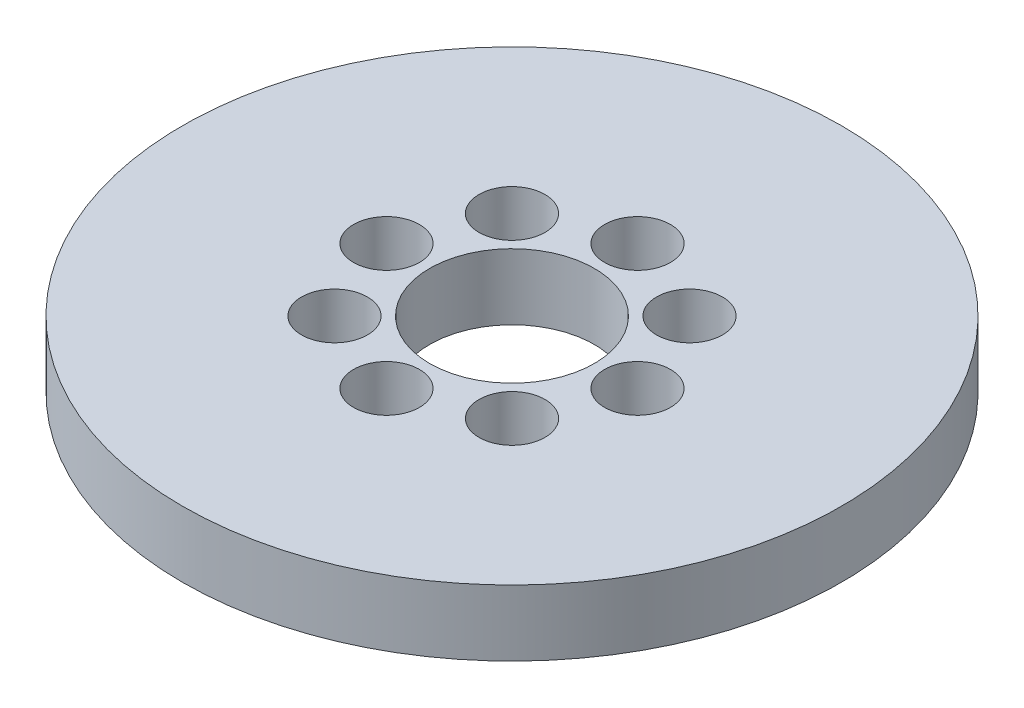
from build123d import *

# Parameters (mm, degrees)
SKETCH1_R           = 100
BOSS_EXTRUDE1_DEPTH = 20
SKETCH2_R           = 25
CUT_EXTRUDE1_DEPTH  = 143.828568571
SKETCH3_R           = 10
CUT_EXTRUDE2_DEPTH  = 17.838821247
CIRPATTERN1_COUNT   = 8


with BuildPart() as part:
    # Sketch1 → Boss-Extrude1 (new body)
    with BuildSketch(Plane(origin=(0, 0, 0), x_dir=(1, 0, 0), z_dir=(0, 1, 0))):
        Circle(SKETCH1_R)
    extrude(amount=BOSS_EXTRUDE1_DEPTH)

    # Sketch2 → Cut-Extrude1 (cut, through all)
    with BuildSketch(Plane(origin=(0, 0, 0), x_dir=(1, 0, 0), z_dir=(0, 1, 0))):
        Circle(SKETCH2_R)
    extrude(amount=CUT_EXTRUDE1_DEPTH, mode=Mode.SUBTRACT)

    # Sketch3 → Cut-Extrude2 (cut)
    with BuildSketch(Plane(origin=(0, 20, 0), x_dir=(1, 0, 0), z_dir=(0, 1, 0))):
        with Locations((-38.089036615, 0)):
            Circle(SKETCH3_R)
    cut_extrude2 = extrude(amount=-CUT_EXTRUDE2_DEPTH, mode=Mode.SUBTRACT)

    # CirPattern1: Cut-Extrude2 ×8 about axis
    cirpattern1_axis = Axis((0, 0, 0), (0, 1, 0))
    for i in range(1, CIRPATTERN1_COUNT):
        add(cut_extrude2.rotate(cirpattern1_axis, i * 360 / CIRPATTERN1_COUNT), mode=Mode.SUBTRACT)


solid = part.part
